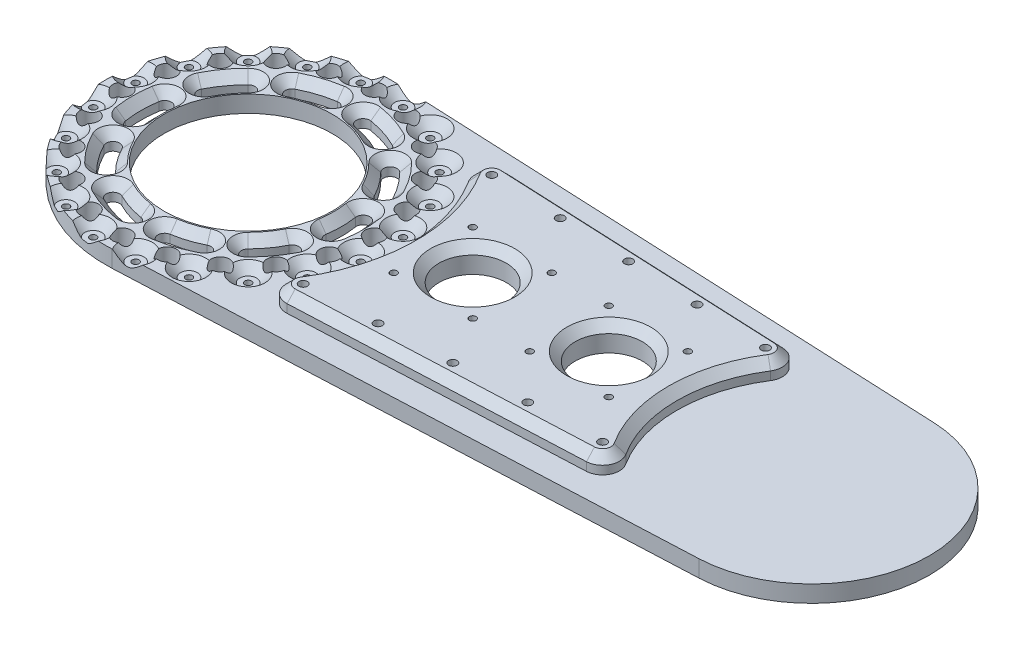
from build123d import *

# Parameters (mm, degrees)
BOSS_EXTRUDE3_OUTLINE_R   = 2
BOSS_EXTRUDE3_OUTLINE_R_2 = 5.5
BOSS_EXTRUDE3_OUTLINE_R_3 = 50
BOSS_EXTRUDE3_DEPTH       = 10
CUT_EXTRUDE1_DEPTH        = 10
SKETCH4_R                 = 5
CUT_EXTRUDE2_DEPTH        = 5
CHAMFER2_SIZE             = 5
SKETCH15_R                = 20
SKETCH15_R_2              = 2
SKETCH15_R_3              = 2.5
CUT_EXTRUDE11_DEPTH       = 10
CUT_EXTRUDE12_START       = 5
SKETCH22_R                = 20
SKETCH22_R_2              = 2
CUT_EXTRUDE12_DEPTH       = 5
BOSS_EXTRUDE10_START      = 20
SKETCH23_R                = 2.5
SKETCH23_R_2              = 20
SKETCH23_R_3              = 2
BOSS_EXTRUDE10_DEPTH      = 15
CHAMFER4_SIZE             = 5
CHAMFER5_SIZE             = 5
SKETCH24_R                = 3.5
SKETCH24_R_2              = 3.53
CUT_EXTRUDE13_DEPTH       = 10


# Read off the part's stored shape, not the designer's step: Boss-Extrude3
with BuildPart() as part:
    # Boss-Extrude3 outline → Boss-Extrude3 (new body)
    with BuildSketch(Plane(origin=(0, 0, 0), x_dir=(1, 0, 0), z_dir=(0, 1, 0))):
        with BuildLine():
            ThreePointArc((338.1374893, -69.914506734), (404.99999947, 0.018309336), (338.131166495, 69.945079648))
            Line((338.131166495, 69.945079648), (3.802131301, 84.914920936))
            ThreePointArc((3.802131301, 84.914920936), (-84.999999913, -0.0038427), (3.809808993, -84.914576814))
            Line((3.809808993, -84.914576814), (338.1374893, -69.914506734))
        make_face()
        with Locations((-36.542992585, -71.727677315)):
            Circle(BOSS_EXTRUDE3_OUTLINE_R, mode=Mode.SUBTRACT)
        with Locations((-12.589379965, -79.509480643)):
            Circle(BOSS_EXTRUDE3_OUTLINE_R, mode=Mode.SUBTRACT)
        with Locations((0, -75)):
            Circle(BOSS_EXTRUDE3_OUTLINE_R_2, mode=Mode.SUBTRACT)
        with Locations((12.596568881, -79.50834203)):
            Circle(BOSS_EXTRUDE3_OUTLINE_R, mode=Mode.SUBTRACT)
        with Locations((-23.176274578, -71.329238722)):
            Circle(BOSS_EXTRUDE3_OUTLINE_R_2, mode=Mode.SUBTRACT)
        with Locations((36.549477799, -71.724372933)):
            Circle(BOSS_EXTRUDE3_OUTLINE_R, mode=Mode.SUBTRACT)
        with Locations((23.176274578, -71.329238722)):
            Circle(BOSS_EXTRUDE3_OUTLINE_R_2, mode=Mode.SUBTRACT)
        with Locations((-56.91952248, -56.924669175)):
            Circle(BOSS_EXTRUDE3_OUTLINE_R, mode=Mode.SUBTRACT)
        with Locations((-44.083893922, -60.676274578)):
            Circle(BOSS_EXTRUDE3_OUTLINE_R_2, mode=Mode.SUBTRACT)
        with Locations((-60.676274578, -44.083893922)):
            Circle(BOSS_EXTRUDE3_OUTLINE_R_2, mode=Mode.SUBTRACT)
        with Locations((44.083893922, -60.676274578)):
            Circle(BOSS_EXTRUDE3_OUTLINE_R_2, mode=Mode.SUBTRACT)
        with Locations((56.924669175, -56.91952248)):
            Circle(BOSS_EXTRUDE3_OUTLINE_R, mode=Mode.SUBTRACT)
        with Locations((60.676274578, -44.083893922)):
            Circle(BOSS_EXTRUDE3_OUTLINE_R_2, mode=Mode.SUBTRACT)
        with Locations((-71.724372933, -36.549477799)):
            Circle(BOSS_EXTRUDE3_OUTLINE_R, mode=Mode.SUBTRACT)
        with Locations((-71.329238722, -23.176274578)):
            Circle(BOSS_EXTRUDE3_OUTLINE_R_2, mode=Mode.SUBTRACT)
        with Locations((-79.50834203, -12.596568881)):
            Circle(BOSS_EXTRUDE3_OUTLINE_R, mode=Mode.SUBTRACT)
        with Locations((71.727677315, -36.542992585)):
            Circle(BOSS_EXTRUDE3_OUTLINE_R, mode=Mode.SUBTRACT)
        with Locations((71.329238722, -23.176274578)):
            Circle(BOSS_EXTRUDE3_OUTLINE_R_2, mode=Mode.SUBTRACT)
        with Locations((79.509480643, -12.589379965)):
            Circle(BOSS_EXTRUDE3_OUTLINE_R, mode=Mode.SUBTRACT)
        with Locations((-75, 0)):
            Circle(BOSS_EXTRUDE3_OUTLINE_R_2, mode=Mode.SUBTRACT)
        with Locations((-79.509480643, 12.589379965)):
            Circle(BOSS_EXTRUDE3_OUTLINE_R, mode=Mode.SUBTRACT)
        Circle(BOSS_EXTRUDE3_OUTLINE_R_3, mode=Mode.SUBTRACT)
        with Locations((-71.329238722, 23.176274578)):
            Circle(BOSS_EXTRUDE3_OUTLINE_R_2, mode=Mode.SUBTRACT)
        with Locations((-71.727677315, 36.542992585)):
            Circle(BOSS_EXTRUDE3_OUTLINE_R, mode=Mode.SUBTRACT)
        with Locations((75, 0)):
            Circle(BOSS_EXTRUDE3_OUTLINE_R_2, mode=Mode.SUBTRACT)
        with Locations((79.50834203, 12.596568881)):
            Circle(BOSS_EXTRUDE3_OUTLINE_R, mode=Mode.SUBTRACT)
        with Locations((71.329238722, 23.176274578)):
            Circle(BOSS_EXTRUDE3_OUTLINE_R_2, mode=Mode.SUBTRACT)
        with Locations((71.724372933, 36.549477799)):
            Circle(BOSS_EXTRUDE3_OUTLINE_R, mode=Mode.SUBTRACT)
        with Locations((-60.676274578, 44.083893922)):
            Circle(BOSS_EXTRUDE3_OUTLINE_R_2, mode=Mode.SUBTRACT)
        with Locations((-56.924669175, 56.91952248)):
            Circle(BOSS_EXTRUDE3_OUTLINE_R, mode=Mode.SUBTRACT)
        with Locations((-44.083893922, 60.676274578)):
            Circle(BOSS_EXTRUDE3_OUTLINE_R_2, mode=Mode.SUBTRACT)
        with Locations((-36.549477799, 71.724372933)):
            Circle(BOSS_EXTRUDE3_OUTLINE_R, mode=Mode.SUBTRACT)
        with Locations((-23.176274578, 71.329238722)):
            Circle(BOSS_EXTRUDE3_OUTLINE_R_2, mode=Mode.SUBTRACT)
        with Locations((23.176274578, 71.329238722)):
            Circle(BOSS_EXTRUDE3_OUTLINE_R_2, mode=Mode.SUBTRACT)
        with Locations((36.542992585, 71.727677315)):
            Circle(BOSS_EXTRUDE3_OUTLINE_R, mode=Mode.SUBTRACT)
        with Locations((-12.596568881, 79.50834203)):
            Circle(BOSS_EXTRUDE3_OUTLINE_R, mode=Mode.SUBTRACT)
        with Locations((0, 75)):
            Circle(BOSS_EXTRUDE3_OUTLINE_R_2, mode=Mode.SUBTRACT)
        with Locations((12.589379965, 79.509480643)):
            Circle(BOSS_EXTRUDE3_OUTLINE_R, mode=Mode.SUBTRACT)
        with Locations((60.676274578, 44.083893922)):
            Circle(BOSS_EXTRUDE3_OUTLINE_R_2, mode=Mode.SUBTRACT)
        with Locations((56.91952248, 56.924669175)):
            Circle(BOSS_EXTRUDE3_OUTLINE_R, mode=Mode.SUBTRACT)
        with Locations((44.083893922, 60.676274578)):
            Circle(BOSS_EXTRUDE3_OUTLINE_R_2, mode=Mode.SUBTRACT)
    extrude(amount=BOSS_EXTRUDE3_DEPTH)

    # Sketch3 → Cut-Extrude1 (cut)
    with BuildSketch(Plane(origin=(0, 10, 0), x_dir=(1, 0, 0), z_dir=(0, 1, 0))):
        with BuildLine():
            ThreePointArc((62.96556447, -9.969964444), (63.74999994, 0.002766756), (62.964698838, 9.97542983))
            ThreePointArc((62.964698838, 9.97542983), (58.388063313, 13.300246709), (55.063246434, 8.723611184))
            ThreePointArc((55.063246434, 8.723611184), (55.749999947, 0.002419555), (55.064003438, -8.718831651))
            ThreePointArc((55.064003438, -8.718831651), (58.389217557, -13.295178563), (62.96556447, -9.969964444))
        make_face()
        with BuildLine():
            ThreePointArc((56.800409782, 28.944359529), (51.573207084, 37.473548151), (45.076100866, 45.08001365))
            ThreePointArc((45.076100866, 45.08001365), (39.419246622, 45.079768142), (39.41949213, 39.422913898))
            ThreePointArc((39.41949213, 39.422913898), (45.101275215, 32.770985246), (49.672515222, 25.312126176))
            ThreePointArc((49.672515222, 25.312126176), (55.052579178, 23.564295572), (56.800409782, 28.944359529))
        make_face()
        with BuildLine():
            ThreePointArc((-9.97542983, 62.964698838), (-19.702464714, 60.628997882), (-28.944359529, 56.800409782))
            ThreePointArc((-28.944359529, 56.800409782), (-30.692190133, 51.420345826), (-25.312126176, 49.672515222))
            ThreePointArc((-25.312126176, 49.672515222), (-17.229998554, 53.02065305), (-8.723611184, 55.063246434))
            ThreePointArc((-8.723611184, 55.063246434), (-5.398794306, 59.639881959), (-9.97542983, 62.964698838))
        make_face()
        with BuildLine():
            ThreePointArc((45.08001365, -45.076100866), (51.576459601, -37.469071446), (56.802921945, -28.939429133))
            ThreePointArc((56.802921945, -28.939429133), (55.054624356, -23.559516909), (49.674712132, -25.307814497))
            ThreePointArc((49.674712132, -25.307814497), (45.104119573, -32.767070323), (39.422913898, -39.41949213))
            ThreePointArc((39.422913898, -39.41949213), (39.423159406, -45.076346374), (45.08001365, -45.076100866))
        make_face()
        with BuildLine():
            ThreePointArc((28.939429133, 56.802921945), (19.697202031, 60.630707831), (9.969964444, 62.96556447))
            ThreePointArc((9.969964444, 62.96556447), (5.393617532, 59.64035035), (8.718831651, 55.064003438))
            ThreePointArc((8.718831651, 55.064003438), (17.225396286, 53.022148417), (25.307814497, 49.674712132))
            ThreePointArc((25.307814497, 49.674712132), (30.687726721, 51.42300972), (28.939429133, 56.802921945))
        make_face()
        with BuildLine():
            ThreePointArc((-62.964698838, -9.97542983), (-58.388063313, -13.300246709), (-55.063246434, -8.723611184))
            ThreePointArc((-55.063246434, -8.723611184), (-55.749999947, -0.002419555), (-55.064003438, 8.718831651))
            ThreePointArc((-55.064003438, 8.718831651), (-58.389217557, 13.295178563), (-62.96556447, 9.969964444))
            ThreePointArc((-62.96556447, 9.969964444), (-63.74999994, -0.002766756), (-62.964698838, -9.97542983))
        make_face()
        with BuildLine():
            ThreePointArc((-56.802921945, 28.939429133), (-55.054624356, 23.559516909), (-49.674712132, 25.307814497))
            ThreePointArc((-49.674712132, 25.307814497), (-45.104119573, 32.767070323), (-39.422913898, 39.41949213))
            ThreePointArc((-39.422913898, 39.41949213), (-39.423159406, 45.076346374), (-45.08001365, 45.076100866))
            ThreePointArc((-45.08001365, 45.076100866), (-51.576459601, 37.469071446), (-56.802921945, 28.939429133))
        make_face()
        with BuildLine():
            ThreePointArc((-45.076100866, -45.08001365), (-39.419246622, -45.079768142), (-39.41949213, -39.422913898))
            ThreePointArc((-39.41949213, -39.422913898), (-45.101275215, -32.770985246), (-49.672515222, -25.312126176))
            ThreePointArc((-49.672515222, -25.312126176), (-55.052579178, -23.564295572), (-56.800409782, -28.944359529))
            ThreePointArc((-56.800409782, -28.944359529), (-51.573207084, -37.473548151), (-45.076100866, -45.08001365))
        make_face()
        with BuildLine():
            ThreePointArc((-25.307814497, -49.674712132), (-30.687726721, -51.42300972), (-28.939429133, -56.802921945))
            ThreePointArc((-28.939429133, -56.802921945), (-19.697202031, -60.630707831), (-9.969964444, -62.96556447))
            ThreePointArc((-9.969964444, -62.96556447), (-5.393617532, -59.64035035), (-8.718831651, -55.064003438))
            ThreePointArc((-8.718831651, -55.064003438), (-17.225396286, -53.022148417), (-25.307814497, -49.674712132))
        make_face()
        with BuildLine():
            ThreePointArc((8.723611184, -55.063246434), (5.398794306, -59.639881959), (9.97542983, -62.964698838))
            ThreePointArc((9.97542983, -62.964698838), (19.702464714, -60.628997882), (28.944359529, -56.800409782))
            ThreePointArc((28.944359529, -56.800409782), (30.692190133, -51.420345826), (25.312126176, -49.672515222))
            ThreePointArc((25.312126176, -49.672515222), (17.229998554, -53.02065305), (8.723611184, -55.063246434))
        make_face()
    extrude(amount=-CUT_EXTRUDE1_DEPTH, mode=Mode.SUBTRACT)

    # Sketch4 → Cut-Extrude2 (cut)
    with BuildSketch(Plane(origin=(0, 10, 0), x_dir=(1, 0, 0), z_dir=(0, 1, 0))):
        with Locations((-79.50834203, -12.596568881)):
            Circle(SKETCH4_R)
        with Locations((-79.509457879, 12.589523729)):
            Circle(SKETCH4_R)
        with Locations((-71.727588476, 36.543266042)):
            Circle(SKETCH4_R)
        with Locations((-56.924477418, 56.919898865)):
            Circle(SKETCH4_R)
        with Locations((-36.549156354, 71.724815405)):
            Circle(SKETCH4_R)
        with Locations((-12.596103674, 79.508807279)):
            Circle(SKETCH4_R)
        with Locations(Location((12.589988936, 79.509923128, 0), (0, 0, 270))):
            Circle(SKETCH4_R)
        with Locations(Location((36.543731249, 71.728053724, 0), (0, 0, 270))):
            Circle(SKETCH4_R)
        with Locations(Location((56.920364072, 56.924942666, 0), (0, 0, 270))):
            Circle(SKETCH4_R)
        with Locations(Location((71.725280612, 36.549621602, 0), (0, 0, 270))):
            Circle(SKETCH4_R)
        with Locations(Location((79.509272486, 12.596568922, 0), (0, 0, 270))):
            Circle(SKETCH4_R)
        with Locations(Location((79.510388335, -12.589523688, 0), (0, 0, 270))):
            Circle(SKETCH4_R)
        with Locations(Location((71.728518931, -36.543266001, 0), (0, 0, 270))):
            Circle(SKETCH4_R)
        with Locations(Location((56.925407873, -56.919898824, 0), (0, 0, 270))):
            Circle(SKETCH4_R)
        with Locations(Location((36.550086809, -71.724815364, 0), (0, 0, 270))):
            Circle(SKETCH4_R)
        with Locations(Location((12.597034129, -79.508807237, 0), (0, 0, 270))):
            Circle(SKETCH4_R)
        with Locations((-12.589058481, -79.509923086)):
            Circle(SKETCH4_R)
        with Locations((-36.542800794, -71.728053683)):
            Circle(SKETCH4_R)
        with Locations((-56.919433617, -56.924942625)):
            Circle(SKETCH4_R)
        with Locations((-71.724350157, -36.549621561)):
            Circle(SKETCH4_R)
    extrude(amount=-CUT_EXTRUDE2_DEPTH, mode=Mode.SUBTRACT)

    # Chamfer2
    # the kernel refuses this chamfer: 5 mm, written as the material it takes off along each edge
    with BuildSketch(Plane(origin=(-59.013972636, 10, 9.349520507), x_dir=(-0.987681550393962, 0, 0.15647733066287803), z_dir=(-0.15647733066287803, 0, -0.987681550393962))) as chamfer2_piece_1:
        Polygon((4 + CHAMFER2_SIZE, 0), (4, -CHAMFER2_SIZE), (4, 0), align=None)
    revolve(axis=Axis((-59.013972636, 10, 9.349520507), (0, 1, 0)), revolution_arc=180, mode=Mode.SUBTRACT)
    with BuildSketch(Plane(origin=(0, 10, 0), x_dir=(-0.9876815503939634, 0, 0.156477330662869), z_dir=(0.156477330662869, 0, 0.9876815503939634))) as chamfer2_piece_2:
        Polygon((55.75 - CHAMFER2_SIZE, 0), (55.75, CHAMFER2_SIZE), (55.75, 0), align=None)
    revolve(axis=Axis((0, 10, 0), (0, -1, 0)), revolution_arc=18, mode=Mode.SUBTRACT)
    with BuildSketch(Plane(origin=(0, 10, 0), x_dir=(-0.9876951289359334, 0, -0.1563915991229388), z_dir=(0.1563915991229388, 0, -0.9876951289359334))) as chamfer2_piece_3:
        Polygon((63.75 + CHAMFER2_SIZE, 0), (63.75, -CHAMFER2_SIZE), (63.75, 0), align=None)
    revolve(axis=Axis((0, 10, 0), (0, 1, 0)), revolution_arc=18, mode=Mode.SUBTRACT)
    with BuildSketch(Plane(origin=(-59.014783954, 10, -9.344398048), x_dir=(0.9876951289359372, 0, 0.15639159912291412), z_dir=(-0.15639159912291412, 0, 0.9876951289359372))) as chamfer2_piece_4:
        Polygon((4 + CHAMFER2_SIZE, 0), (4, -CHAMFER2_SIZE), (4, 0), align=None)
    revolve(axis=Axis((-59.014783954, 10, -9.344398048), (0, 1, 0)), revolution_arc=180, mode=Mode.SUBTRACT)
    with BuildSketch(Plane(origin=(-42.247796498, 10, 42.251463774), x_dir=(-0.707076092017545, 0, 0.707137469023666), z_dir=(-0.707137469023666, 0, -0.707076092017545))) as chamfer2_piece_5:
        Polygon((4 + CHAMFER2_SIZE, 0), (4, -CHAMFER2_SIZE), (4, 0), align=None)
    revolve(axis=Axis((-42.247796498, 10, 42.251463774), (0, 1, 0)), revolution_arc=180, mode=Mode.SUBTRACT)
    with BuildSketch(Plane(origin=(0, 10, 0), x_dir=(-0.7070760920176004, 0, 0.7071374690236107), z_dir=(0.7071374690236107, 0, 0.7070760920176004))) as chamfer2_piece_6:
        Polygon((55.75 - CHAMFER2_SIZE, 0), (55.75, CHAMFER2_SIZE), (55.75, 0), align=None)
    revolve(axis=Axis((0, 10, 0), (0, -1, 0)), revolution_arc=18, mode=Mode.SUBTRACT)
    with BuildSketch(Plane(origin=(0, 10, 0), x_dir=(-0.8909868201174173, 0, 0.45402916908173774), z_dir=(-0.45402916908173774, 0, -0.8909868201174173))) as chamfer2_piece_7:
        Polygon((63.75 + CHAMFER2_SIZE, 0), (63.75, -CHAMFER2_SIZE), (63.75, 0), align=None)
    revolve(axis=Axis((0, 10, 0), (0, 1, 0)), revolution_arc=18, mode=Mode.SUBTRACT)
    with BuildSketch(Plane(origin=(-53.236462502, 10, 27.128242853), x_dir=(0.8909868201174534, 0, -0.4540291690816666), z_dir=(0.4540291690816666, 0, 0.8909868201174534))) as chamfer2_piece_8:
        Polygon((4 + CHAMFER2_SIZE, 0), (4, -CHAMFER2_SIZE), (4, 0), align=None)
    revolve(axis=Axis((-53.236462502, 10, 27.128242853), (0, 1, 0)), revolution_arc=180, mode=Mode.SUBTRACT)
    with BuildSketch(Plane(origin=(-9.344398048, 10, 59.014783954), x_dir=(-0.15639159912293782, 0, 0.9876951289359336), z_dir=(-0.9876951289359336, 0, -0.15639159912293782))) as chamfer2_piece_9:
        Polygon((4 + CHAMFER2_SIZE, 0), (4, -CHAMFER2_SIZE), (4, 0), align=None)
    revolve(axis=Axis((-9.344398048, 10, 59.014783954), (0, 1, 0)), revolution_arc=180, mode=Mode.SUBTRACT)
    with BuildSketch(Plane(origin=(0, 10, 0), x_dir=(-0.156391599122972, 0, 0.9876951289359281), z_dir=(0.9876951289359281, 0, 0.156391599122972))) as chamfer2_piece_10:
        Polygon((55.75 - CHAMFER2_SIZE, 0), (55.75, CHAMFER2_SIZE), (55.75, 0), align=None)
    revolve(axis=Axis((0, 10, 0), (0, -1, 0)), revolution_arc=18, mode=Mode.SUBTRACT)
    with BuildSketch(Plane(origin=(0, 10, 0), x_dir=(-0.45395182954222274, 0, 0.8910262265810523), z_dir=(-0.8910262265810523, 0, -0.45395182954222274))) as chamfer2_piece_11:
        Polygon((63.75 + CHAMFER2_SIZE, 0), (63.75, -CHAMFER2_SIZE), (63.75, 0), align=None)
    revolve(axis=Axis((0, 10, 0), (0, 1, 0)), revolution_arc=18, mode=Mode.SUBTRACT)
    with BuildSketch(Plane(origin=(-27.123621815, 10, 53.238817038), x_dir=(0.45395182954229385, 0, -0.891026226581016), z_dir=(0.891026226581016, 0, 0.45395182954229385))) as chamfer2_piece_12:
        Polygon((4 + CHAMFER2_SIZE, 0), (4, -CHAMFER2_SIZE), (4, 0), align=None)
    revolve(axis=Axis((-27.123621815, 10, 53.238817038), (0, 1, 0)), revolution_arc=180, mode=Mode.SUBTRACT)
    with BuildSketch(Plane(origin=(9.349520507, 10, 59.013972636), x_dir=(-0.1564773306628907, 0, -0.98768155039396), z_dir=(0.98768155039396, 0, -0.1564773306628907))) as chamfer2_piece_13:
        Polygon((4 + CHAMFER2_SIZE, 0), (4, -CHAMFER2_SIZE), (4, 0), align=None)
    revolve(axis=Axis((9.349520507, 10, 59.013972636), (0, 1, 0)), revolution_arc=180, mode=Mode.SUBTRACT)
    with BuildSketch(Plane(origin=(0, 10, 0), x_dir=(0.1564773306628972, 0, 0.9876815503939589), z_dir=(-0.9876815503939589, 0, 0.1564773306628972))) as chamfer2_piece_14:
        Polygon((63.75 + CHAMFER2_SIZE, 0), (63.75, -CHAMFER2_SIZE), (63.75, 0), align=None)
    revolve(axis=Axis((0, 10, 0), (0, 1, 0)), revolution_arc=18, mode=Mode.SUBTRACT)
    with BuildSketch(Plane(origin=(0, 10, 0), x_dir=(0.4540291690816931, 0, 0.89098682011744), z_dir=(0.89098682011744, 0, -0.4540291690816931))) as chamfer2_piece_15:
        Polygon((55.75 - CHAMFER2_SIZE, 0), (55.75, CHAMFER2_SIZE), (55.75, 0), align=None)
    revolve(axis=Axis((0, 10, 0), (0, -1, 0)), revolution_arc=18, mode=Mode.SUBTRACT)
    with BuildSketch(Plane(origin=(27.128242853, 10, 53.236462502), x_dir=(0.45402916908164603, 0, 0.890986820117464), z_dir=(-0.890986820117464, 0, 0.45402916908164603))) as chamfer2_piece_16:
        Polygon((4 + CHAMFER2_SIZE, 0), (4, -CHAMFER2_SIZE), (4, 0), align=None)
    revolve(axis=Axis((27.128242853, 10, 53.236462502), (0, 1, 0)), revolution_arc=180, mode=Mode.SUBTRACT)
    with BuildSketch(Plane(origin=(42.251463774, 10, 42.247796498), x_dir=(-0.7071374690237141, 0, -0.7070760920174971), z_dir=(0.7070760920174971, 0, -0.7071374690237141))) as chamfer2_piece_17:
        Polygon((4 + CHAMFER2_SIZE, 0), (4, -CHAMFER2_SIZE), (4, 0), align=None)
    revolve(axis=Axis((42.251463774, 10, 42.247796498), (0, 1, 0)), revolution_arc=180, mode=Mode.SUBTRACT)
    with BuildSketch(Plane(origin=(0, 10, 0), x_dir=(0.7071374690236412, 0, 0.7070760920175699), z_dir=(-0.7070760920175699, 0, 0.7071374690236412))) as chamfer2_piece_18:
        Polygon((63.75 + CHAMFER2_SIZE, 0), (63.75, -CHAMFER2_SIZE), (63.75, 0), align=None)
    revolve(axis=Axis((0, 10, 0), (0, 1, 0)), revolution_arc=18, mode=Mode.SUBTRACT)
    with BuildSketch(Plane(origin=(0, 10, 0), x_dir=(0.8910262265810269, 0, 0.4539518295422725), z_dir=(0.4539518295422725, 0, -0.8910262265810269))) as chamfer2_piece_19:
        Polygon((55.75 - CHAMFER2_SIZE, 0), (55.75, CHAMFER2_SIZE), (55.75, 0), align=None)
    revolve(axis=Axis((0, 10, 0), (0, -1, 0)), revolution_arc=18, mode=Mode.SUBTRACT)
    with BuildSketch(Plane(origin=(53.238817038, 10, 27.123621815), x_dir=(0.8910262265809425, 0, 0.4539518295424383), z_dir=(-0.4539518295424383, 0, 0.8910262265809425))) as chamfer2_piece_20:
        Polygon((4 + CHAMFER2_SIZE, 0), (4, -CHAMFER2_SIZE), (4, 0), align=None)
    revolve(axis=Axis((53.238817038, 10, 27.123621815), (0, 1, 0)), revolution_arc=180, mode=Mode.SUBTRACT)
    with BuildSketch(Plane(origin=(59.014783954, 10, 9.344398048), x_dir=(-0.9876951289359776, 0, -0.15639159912265974), z_dir=(0.15639159912265974, 0, -0.9876951289359776))) as chamfer2_piece_21:
        Polygon((4 + CHAMFER2_SIZE, 0), (4, -CHAMFER2_SIZE), (4, 0), align=None)
    revolve(axis=Axis((59.014783954, 10, 9.344398048), (0, 1, 0)), revolution_arc=180, mode=Mode.SUBTRACT)
    with BuildSketch(Plane(origin=(0, 10, 0), x_dir=(0.9876951289359344, 0, 0.15639159912293288), z_dir=(-0.15639159912293288, 0, 0.9876951289359344))) as chamfer2_piece_22:
        Polygon((63.75 + CHAMFER2_SIZE, 0), (63.75, -CHAMFER2_SIZE), (63.75, 0), align=None)
    revolve(axis=Axis((0, 10, 0), (0, 1, 0)), revolution_arc=18, mode=Mode.SUBTRACT)
    with BuildSketch(Plane(origin=(0, 10, 0), x_dir=(0.9876815503939652, 0, -0.15647733066285652), z_dir=(-0.15647733066285652, 0, -0.9876815503939652))) as chamfer2_piece_23:
        Polygon((55.75 - CHAMFER2_SIZE, 0), (55.75, CHAMFER2_SIZE), (55.75, 0), align=None)
    revolve(axis=Axis((0, 10, 0), (0, -1, 0)), revolution_arc=18, mode=Mode.SUBTRACT)
    with BuildSketch(Plane(origin=(59.013972636, 10, -9.349520507), x_dir=(0.9876815503940178, 0, -0.15647733066252528), z_dir=(0.15647733066252528, 0, 0.9876815503940178))) as chamfer2_piece_24:
        Polygon((4 + CHAMFER2_SIZE, 0), (4, -CHAMFER2_SIZE), (4, 0), align=None)
    revolve(axis=Axis((59.013972636, 10, -9.349520507), (0, 1, 0)), revolution_arc=180, mode=Mode.SUBTRACT)
    with BuildSketch(Plane(origin=(53.236462502, 10, -27.128242853), x_dir=(-0.8909868201172598, 0, 0.45402916908204666), z_dir=(-0.45402916908204666, 0, -0.8909868201172598))) as chamfer2_piece_25:
        Polygon((4 + CHAMFER2_SIZE, 0), (4, -CHAMFER2_SIZE), (4, 0), align=None)
    revolve(axis=Axis((53.236462502, 10, -27.128242853), (0, 1, 0)), revolution_arc=180, mode=Mode.SUBTRACT)
    with BuildSketch(Plane(origin=(0, 10, 0), x_dir=(0.8909868201174278, 0, -0.45402916908171703), z_dir=(0.45402916908171703, 0, 0.8909868201174278))) as chamfer2_piece_26:
        Polygon((63.75 + CHAMFER2_SIZE, 0), (63.75, -CHAMFER2_SIZE), (63.75, 0), align=None)
    revolve(axis=Axis((0, 10, 0), (0, 1, 0)), revolution_arc=18, mode=Mode.SUBTRACT)
    with BuildSketch(Plane(origin=(0, 10, 0), x_dir=(0.7070760920175798, 0, -0.7071374690236313), z_dir=(-0.7071374690236313, 0, -0.7070760920175798))) as chamfer2_piece_27:
        Polygon((55.75 - CHAMFER2_SIZE, 0), (55.75, CHAMFER2_SIZE), (55.75, 0), align=None)
    revolve(axis=Axis((0, 10, 0), (0, -1, 0)), revolution_arc=18, mode=Mode.SUBTRACT)
    with BuildSketch(Plane(origin=(42.247796498, 10, -42.251463774), x_dir=(0.7070760920178728, 0, -0.7071374690233384), z_dir=(0.7071374690233384, 0, 0.7070760920178728))) as chamfer2_piece_28:
        Polygon((4 + CHAMFER2_SIZE, 0), (4, -CHAMFER2_SIZE), (4, 0), align=None)
    revolve(axis=Axis((42.247796498, 10, -42.251463774), (0, 1, 0)), revolution_arc=180, mode=Mode.SUBTRACT)
    with BuildSketch(Plane(origin=(27.123621815, 10, -53.238817038), x_dir=(-0.45395182954191593, 0, 0.8910262265812087), z_dir=(-0.8910262265812087, 0, -0.45395182954191593))) as chamfer2_piece_29:
        Polygon((4 + CHAMFER2_SIZE, 0), (4, -CHAMFER2_SIZE), (4, 0), align=None)
    revolve(axis=Axis((27.123621815, 10, -53.238817038), (0, 1, 0)), revolution_arc=180, mode=Mode.SUBTRACT)
    with BuildSketch(Plane(origin=(0, 10, 0), x_dir=(0.45395182954226415, 0, -0.8910262265810311), z_dir=(0.8910262265810311, 0, 0.45395182954226415))) as chamfer2_piece_30:
        Polygon((63.75 + CHAMFER2_SIZE, 0), (63.75, -CHAMFER2_SIZE), (63.75, 0), align=None)
    revolve(axis=Axis((0, 10, 0), (0, 1, 0)), revolution_arc=18, mode=Mode.SUBTRACT)
    with BuildSketch(Plane(origin=(0, 10, 0), x_dir=(0.15639159912291864, 0, -0.9876951289359365), z_dir=(-0.9876951289359365, 0, -0.15639159912291864))) as chamfer2_piece_31:
        Polygon((55.75 - CHAMFER2_SIZE, 0), (55.75, CHAMFER2_SIZE), (55.75, 0), align=None)
    revolve(axis=Axis((0, 10, 0), (0, -1, 0)), revolution_arc=18, mode=Mode.SUBTRACT)
    with BuildSketch(Plane(origin=(9.344398048, 10, -59.014783954), x_dir=(0.1563915991233011, 0, -0.987695128935876), z_dir=(0.987695128935876, 0, 0.1563915991233011))) as chamfer2_piece_32:
        Polygon((4 + CHAMFER2_SIZE, 0), (4, -CHAMFER2_SIZE), (4, 0), align=None)
    revolve(axis=Axis((9.344398048, 10, -59.014783954), (0, 1, 0)), revolution_arc=180, mode=Mode.SUBTRACT)
    with BuildSketch(Plane(origin=(-9.349520507, 10, -59.013972636), x_dir=(0.15647733066316172, 0, 0.987681550393917), z_dir=(-0.987681550393917, 0, 0.15647733066316172))) as chamfer2_piece_33:
        Polygon((4 + CHAMFER2_SIZE, 0), (4, -CHAMFER2_SIZE), (4, 0), align=None)
    revolve(axis=Axis((-9.349520507, 10, -59.013972636), (0, 1, 0)), revolution_arc=180, mode=Mode.SUBTRACT)
    with BuildSketch(Plane(origin=(0, 10, 0), x_dir=(-0.15647733066284794, 0, -0.9876815503939667), z_dir=(0.9876815503939667, 0, -0.15647733066284794))) as chamfer2_piece_34:
        Polygon((63.75 + CHAMFER2_SIZE, 0), (63.75, -CHAMFER2_SIZE), (63.75, 0), align=None)
    revolve(axis=Axis((0, 10, 0), (0, 1, 0)), revolution_arc=18, mode=Mode.SUBTRACT)
    with BuildSketch(Plane(origin=(0, 10, 0), x_dir=(-0.45402916908174695, 0, -0.8909868201174126), z_dir=(-0.8909868201174126, 0, 0.45402916908174695))) as chamfer2_piece_35:
        Polygon((55.75 - CHAMFER2_SIZE, 0), (55.75, CHAMFER2_SIZE), (55.75, 0), align=None)
    revolve(axis=Axis((0, 10, 0), (0, -1, 0)), revolution_arc=18, mode=Mode.SUBTRACT)
    with BuildSketch(Plane(origin=(-27.128242853, 10, -53.236462502), x_dir=(-0.4540291690814938, 0, -0.8909868201175415), z_dir=(0.8909868201175415, 0, -0.4540291690814938))) as chamfer2_piece_36:
        Polygon((4 + CHAMFER2_SIZE, 0), (4, -CHAMFER2_SIZE), (4, 0), align=None)
    revolve(axis=Axis((-27.128242853, 10, -53.236462502), (0, 1, 0)), revolution_arc=180, mode=Mode.SUBTRACT)
    with BuildSketch(Plane(origin=(-53.238817038, 10, -27.123621815), x_dir=(-0.8910262265809897, 0, -0.45395182954234553), z_dir=(0.45395182954234553, 0, -0.8910262265809897))) as chamfer2_piece_37:
        Polygon((4 + CHAMFER2_SIZE, 0), (4, -CHAMFER2_SIZE), (4, 0), align=None)
    revolve(axis=Axis((-53.238817038, 10, -27.123621815), (0, 1, 0)), revolution_arc=180, mode=Mode.SUBTRACT)
    with BuildSketch(Plane(origin=(0, 10, 0), x_dir=(-0.8910262265810451, 0, -0.4539518295422369), z_dir=(-0.4539518295422369, 0, 0.8910262265810451))) as chamfer2_piece_38:
        Polygon((55.75 - CHAMFER2_SIZE, 0), (55.75, CHAMFER2_SIZE), (55.75, 0), align=None)
    revolve(axis=Axis((0, 10, 0), (0, -1, 0)), revolution_arc=18, mode=Mode.SUBTRACT)
    with BuildSketch(Plane(origin=(0, 10, 0), x_dir=(-0.7071374690236155, 0, -0.7070760920175956), z_dir=(0.7070760920175956, 0, -0.7071374690236155))) as chamfer2_piece_39:
        Polygon((63.75 + CHAMFER2_SIZE, 0), (63.75, -CHAMFER2_SIZE), (63.75, 0), align=None)
    revolve(axis=Axis((0, 10, 0), (0, 1, 0)), revolution_arc=18, mode=Mode.SUBTRACT)
    with BuildSketch(Plane(origin=(-42.251463774, 10, -42.247796498), x_dir=(0.7071374690237363, 0, 0.7070760920174749), z_dir=(-0.7070760920174749, 0, 0.7071374690237363))) as chamfer2_piece_40:
        Polygon((4 + CHAMFER2_SIZE, 0), (4, -CHAMFER2_SIZE), (4, 0), align=None)
    revolve(axis=Axis((-42.251463774, 10, -42.247796498), (0, 1, 0)), revolution_arc=180, mode=Mode.SUBTRACT)
    with BuildSketch(Plane(origin=(-79.50834203, 10, 12.596568881), x_dir=(-0.9881679862865175, 0, 0.15337545722327575), z_dir=(0.15337545722327575, 0, 0.9881679862865175))) as chamfer2_piece_41_section:
        Polygon((5 + CHAMFER2_SIZE, 0), (5, CHAMFER2_SIZE), (5, 0), align=None)
    chamfer2_piece_41 = revolve(axis=Axis((-79.50834203, 10, 12.596568881), (0, -1, 0)), revolution_arc=359.64, mode=Mode.PRIVATE)
    chamfer2_piece_41 = split(chamfer2_piece_41, bisect_by=Plane(origin=(-72.088913494, 5, 11.421103008), z_dir=(0, 1, 0)), keep=Keep.TOP, mode=Mode.PRIVATE)
    add(chamfer2_piece_41, mode=Mode.SUBTRACT)
    with BuildSketch(Plane(origin=(-71.724350157, 10, 36.549621561), x_dir=(-0.8924072037961467, 0, 0.4512309637123132), z_dir=(0.4512309637123132, 0, 0.8924072037961467))) as chamfer2_piece_42_section:
        Polygon((5 + CHAMFER2_SIZE, 0), (5, CHAMFER2_SIZE), (5, 0), align=None)
    chamfer2_piece_42 = revolve(axis=Axis((-71.724350157, 10, 36.549621561), (0, -1, 0)), revolution_arc=359.64, mode=Mode.PRIVATE)
    chamfer2_piece_42 = split(chamfer2_piece_42, bisect_by=Plane(origin=(-65.031299096, 5, 33.138946068), z_dir=(0, 1, 0)), keep=Keep.TOP, mode=Mode.PRIVATE)
    add(chamfer2_piece_42, mode=Mode.SUBTRACT)
    with BuildSketch(Plane(origin=(-56.919433617, 10, 56.924942625), x_dir=(-0.7092906190259605, 0, 0.7049161778266758), z_dir=(0.7049161778266758, 0, 0.7092906190259605))) as chamfer2_piece_43_section:
        Polygon((5 + CHAMFER2_SIZE, 0), (5, CHAMFER2_SIZE), (5, 0), align=None)
    chamfer2_piece_43 = revolve(axis=Axis((-56.919433617, 10, 56.924942625), (0, -1, 0)), revolution_arc=359.64, mode=Mode.PRIVATE)
    chamfer2_piece_43 = split(chamfer2_piece_43, bisect_by=Plane(origin=(-51.607928252, 5, 51.61292318), z_dir=(0, 1, 0)), keep=Keep.TOP, mode=Mode.PRIVATE)
    add(chamfer2_piece_43, mode=Mode.SUBTRACT)
    with BuildSketch(Plane(origin=(-36.542800794, 10, 71.728053683), x_dir=(-0.4567434411585104, 0, 0.8895984650159207), z_dir=(0.8895984650159207, 0, 0.4567434411585104))) as chamfer2_piece_44_section:
        Polygon((5 + CHAMFER2_SIZE, 0), (5, CHAMFER2_SIZE), (5, 0), align=None)
    chamfer2_piece_44 = revolve(axis=Axis((-36.542800794, 10, 71.728053683), (0, -1, 0)), revolution_arc=359.64, mode=Mode.PRIVATE)
    chamfer2_piece_44 = split(chamfer2_piece_44, bisect_by=Plane(origin=(-33.132770402, 5, 65.034673928), z_dir=(0, 1, 0)), keep=Keep.TOP, mode=Mode.PRIVATE)
    add(chamfer2_piece_44, mode=Mode.SUBTRACT)
    with BuildSketch(Plane(origin=(-12.589058481, 10, 79.509923086), x_dir=(-0.15948723054608585, 0, 0.9871999915380569), z_dir=(0.9871999915380569, 0, 0.15948723054608585))) as chamfer2_piece_45_section:
        Polygon((5 + CHAMFER2_SIZE, 0), (5, CHAMFER2_SIZE), (5, 0), align=None)
    chamfer2_piece_45 = revolve(axis=Axis((-12.589058481, 10, 79.509923086), (0, -1, 0)), revolution_arc=359.64, mode=Mode.PRIVATE)
    chamfer2_piece_45 = split(chamfer2_piece_45, bisect_by=Plane(origin=(-11.414299096, 5, 72.090382655), z_dir=(0, 1, 0)), keep=Keep.TOP, mode=Mode.PRIVATE)
    add(chamfer2_piece_45, mode=Mode.SUBTRACT)
    with BuildSketch(Plane(origin=(12.597034129, 10, 79.508807237), x_dir=(0, 0, 1), z_dir=(-1, 0, 0))) as chamfer2_piece_46_section:
        Polygon((5 + CHAMFER2_SIZE, 0), (5, -CHAMFER2_SIZE), (5, 0), align=None)
    chamfer2_piece_46 = revolve(axis=Axis((12.597034129, 10, 79.508807237), (0, 1, 0)), mode=Mode.PRIVATE)
    chamfer2_piece_46 = split(chamfer2_piece_46, bisect_by=Plane(origin=(12.597034129, 5, 71.996860388), z_dir=(0, 1, 0)), keep=Keep.TOP, mode=Mode.PRIVATE)
    add(chamfer2_piece_46, mode=Mode.SUBTRACT)
    with BuildSketch(Plane(origin=(36.550086809, 10, 71.724815364), x_dir=(0, 0, 1), z_dir=(-1, 0, 0))) as chamfer2_piece_47_section:
        Polygon((5 + CHAMFER2_SIZE, 0), (5, -CHAMFER2_SIZE), (5, 0), align=None)
    chamfer2_piece_47 = revolve(axis=Axis((36.550086809, 10, 71.724815364), (0, 1, 0)), mode=Mode.PRIVATE)
    chamfer2_piece_47 = split(chamfer2_piece_47, bisect_by=Plane(origin=(36.550086809, 5, 64.212868518), z_dir=(0, 1, 0)), keep=Keep.TOP, mode=Mode.PRIVATE)
    add(chamfer2_piece_47, mode=Mode.SUBTRACT)
    with BuildSketch(Plane(origin=(56.925407873, 10, 56.919898824), x_dir=(0, 0, 1), z_dir=(-1, 0, 0))) as chamfer2_piece_48_section:
        Polygon((5 + CHAMFER2_SIZE, 0), (5, -CHAMFER2_SIZE), (5, 0), align=None)
    chamfer2_piece_48 = revolve(axis=Axis((56.925407873, 10, 56.919898824), (0, 1, 0)), mode=Mode.PRIVATE)
    chamfer2_piece_48 = split(chamfer2_piece_48, bisect_by=Plane(origin=(56.925407873, 5, 49.407951977), z_dir=(0, 1, 0)), keep=Keep.TOP, mode=Mode.PRIVATE)
    add(chamfer2_piece_48, mode=Mode.SUBTRACT)
    with BuildSketch(Plane(origin=(71.728518931, 10, 36.543266001), x_dir=(0, 0, 1), z_dir=(-1, 0, 0))) as chamfer2_piece_49_section:
        Polygon((5 + CHAMFER2_SIZE, 0), (5, -CHAMFER2_SIZE), (5, 0), align=None)
    chamfer2_piece_49 = revolve(axis=Axis((71.728518931, 10, 36.543266001), (0, 1, 0)), mode=Mode.PRIVATE)
    chamfer2_piece_49 = split(chamfer2_piece_49, bisect_by=Plane(origin=(71.728518931, 5, 29.031319155), z_dir=(0, 1, 0)), keep=Keep.TOP, mode=Mode.PRIVATE)
    add(chamfer2_piece_49, mode=Mode.SUBTRACT)
    with BuildSketch(Plane(origin=(79.510388335, 10, 12.589523688), x_dir=(0, 0, 1), z_dir=(-1, 0, 0))) as chamfer2_piece_50_section:
        Polygon((5 + CHAMFER2_SIZE, 0), (5, -CHAMFER2_SIZE), (5, 0), align=None)
    chamfer2_piece_50 = revolve(axis=Axis((79.510388335, 10, 12.589523688), (0, 1, 0)), mode=Mode.PRIVATE)
    chamfer2_piece_50 = split(chamfer2_piece_50, bisect_by=Plane(origin=(79.510388335, 5, 5.07757684), z_dir=(0, 1, 0)), keep=Keep.TOP, mode=Mode.PRIVATE)
    add(chamfer2_piece_50, mode=Mode.SUBTRACT)
    with BuildSketch(Plane(origin=(79.509272486, 10, -12.596568922), x_dir=(0, 0, 1), z_dir=(-1, 0, 0))) as chamfer2_piece_51_section:
        Polygon((5 + CHAMFER2_SIZE, 0), (5, -CHAMFER2_SIZE), (5, 0), align=None)
    chamfer2_piece_51 = revolve(axis=Axis((79.509272486, 10, -12.596568922), (0, 1, 0)), mode=Mode.PRIVATE)
    chamfer2_piece_51 = split(chamfer2_piece_51, bisect_by=Plane(origin=(79.509272486, 5, -20.108515768), z_dir=(0, 1, 0)), keep=Keep.TOP, mode=Mode.PRIVATE)
    add(chamfer2_piece_51, mode=Mode.SUBTRACT)
    with BuildSketch(Plane(origin=(71.725280612, 10, -36.549621602), x_dir=(0, 0, 1), z_dir=(-1, 0, 0))) as chamfer2_piece_52_section:
        Polygon((5 + CHAMFER2_SIZE, 0), (5, -CHAMFER2_SIZE), (5, 0), align=None)
    chamfer2_piece_52 = revolve(axis=Axis((71.725280612, 10, -36.549621602), (0, 1, 0)), mode=Mode.PRIVATE)
    chamfer2_piece_52 = split(chamfer2_piece_52, bisect_by=Plane(origin=(71.725280612, 5, -44.061568451), z_dir=(0, 1, 0)), keep=Keep.TOP, mode=Mode.PRIVATE)
    add(chamfer2_piece_52, mode=Mode.SUBTRACT)
    with BuildSketch(Plane(origin=(56.920364072, 10, -56.924942666), x_dir=(0, 0, 1), z_dir=(-1, 0, 0))) as chamfer2_piece_53_section:
        Polygon((5 + CHAMFER2_SIZE, 0), (5, -CHAMFER2_SIZE), (5, 0), align=None)
    chamfer2_piece_53 = revolve(axis=Axis((56.920364072, 10, -56.924942666), (0, 1, 0)), mode=Mode.PRIVATE)
    chamfer2_piece_53 = split(chamfer2_piece_53, bisect_by=Plane(origin=(56.920364072, 5, -64.436889514), z_dir=(0, 1, 0)), keep=Keep.TOP, mode=Mode.PRIVATE)
    add(chamfer2_piece_53, mode=Mode.SUBTRACT)
    with BuildSketch(Plane(origin=(36.543731249, 10, -71.728053724), x_dir=(0, 0, 1), z_dir=(-1, 0, 0))) as chamfer2_piece_54_section:
        Polygon((5 + CHAMFER2_SIZE, 0), (5, -CHAMFER2_SIZE), (5, 0), align=None)
    chamfer2_piece_54 = revolve(axis=Axis((36.543731249, 10, -71.728053724), (0, 1, 0)), mode=Mode.PRIVATE)
    chamfer2_piece_54 = split(chamfer2_piece_54, bisect_by=Plane(origin=(36.543731249, 5, -79.24000057), z_dir=(0, 1, 0)), keep=Keep.TOP, mode=Mode.PRIVATE)
    add(chamfer2_piece_54, mode=Mode.SUBTRACT)
    with BuildSketch(Plane(origin=(12.589988936, 10, -79.509923128), x_dir=(0, 0, 1), z_dir=(-1, 0, 0))) as chamfer2_piece_55_section:
        Polygon((5 + CHAMFER2_SIZE, 0), (5, -CHAMFER2_SIZE), (5, 0), align=None)
    chamfer2_piece_55 = revolve(axis=Axis((12.589988936, 10, -79.509923128), (0, 1, 0)), mode=Mode.PRIVATE)
    chamfer2_piece_55 = split(chamfer2_piece_55, bisect_by=Plane(origin=(12.589988936, 5, -87.021869977), z_dir=(0, 1, 0)), keep=Keep.TOP, mode=Mode.PRIVATE)
    add(chamfer2_piece_55, mode=Mode.SUBTRACT)
    with BuildSketch(Plane(origin=(-12.596103674, 10, -79.508807279), x_dir=(-0.1533689233454433, 0, -0.9881690004001641), z_dir=(-0.9881690004001641, 0, 0.1533689233454433))) as chamfer2_piece_56_section:
        Polygon((5 + CHAMFER2_SIZE, 0), (5, CHAMFER2_SIZE), (5, 0), align=None)
    chamfer2_piece_56 = revolve(axis=Axis((-12.596103674, 10, -79.508807279), (0, -1, 0)), revolution_arc=359.64, mode=Mode.PRIVATE)
    chamfer2_piece_56 = split(chamfer2_piece_56, bisect_by=Plane(origin=(-11.42068686, 5, -72.089370971), z_dir=(0, 1, 0)), keep=Keep.TOP, mode=Mode.PRIVATE)
    add(chamfer2_piece_56, mode=Mode.SUBTRACT)
    with BuildSketch(Plane(origin=(-36.549156354, 10, -71.724815405), x_dir=(-0.45122402700266107, 0, -0.8924107111949642), z_dir=(-0.8924107111949642, 0, 0.45122402700266107))) as chamfer2_piece_57_section:
        Polygon((5 + CHAMFER2_SIZE, 0), (5, CHAMFER2_SIZE), (5, 0), align=None)
    chamfer2_piece_57 = revolve(axis=Axis((-36.549156354, 10, -71.724815405), (0, -1, 0)), revolution_arc=359.64, mode=Mode.PRIVATE)
    chamfer2_piece_57 = split(chamfer2_piece_57, bisect_by=Plane(origin=(-33.138532886, 5, -65.031737833), z_dir=(0, 1, 0)), keep=Keep.TOP, mode=Mode.PRIVATE)
    add(chamfer2_piece_57, mode=Mode.SUBTRACT)
    with BuildSketch(Plane(origin=(-56.924477418, 10, -56.919898865), x_dir=(-0.7049103807429796, 0, -0.7092963803099431), z_dir=(-0.7092963803099431, 0, 0.7049103807429796))) as chamfer2_piece_58_section:
        Polygon((5 + CHAMFER2_SIZE, 0), (5, CHAMFER2_SIZE), (5, 0), align=None)
    chamfer2_piece_58 = revolve(axis=Axis((-56.924477418, 10, -56.919898865), (0, -1, 0)), revolution_arc=359.64, mode=Mode.PRIVATE)
    chamfer2_piece_58 = split(chamfer2_piece_58, bisect_by=Plane(origin=(-51.612501385, 5, -51.608350085), z_dir=(0, 1, 0)), keep=Keep.TOP, mode=Mode.PRIVATE)
    add(chamfer2_piece_58, mode=Mode.SUBTRACT)
    with BuildSketch(Plane(origin=(-71.727588476, 10, -36.543266042), x_dir=(-0.8895949147137159, 0, -0.4567503560102572), z_dir=(-0.4567503560102572, 0, 0.8895949147137159))) as chamfer2_piece_59_section:
        Polygon((5 + CHAMFER2_SIZE, 0), (5, CHAMFER2_SIZE), (5, 0), align=None)
    chamfer2_piece_59 = revolve(axis=Axis((-71.727588476, 10, -36.543266042), (0, -1, 0)), revolution_arc=359.64, mode=Mode.PRIVATE)
    chamfer2_piece_59 = split(chamfer2_piece_59, bisect_by=Plane(origin=(-65.034235227, 5, -33.133183622), z_dir=(0, 1, 0)), keep=Keep.TOP, mode=Mode.PRIVATE)
    add(chamfer2_piece_59, mode=Mode.SUBTRACT)
    with BuildSketch(Plane(origin=(-79.509457879, 10, -12.589523729), x_dir=(-0.9871989369688595, 0, -0.1594937580206624), z_dir=(-0.1594937580206624, 0, 0.9871989369688595))) as chamfer2_piece_60_section:
        Polygon((5 + CHAMFER2_SIZE, 0), (5, CHAMFER2_SIZE), (5, 0), align=None)
    chamfer2_piece_60 = revolve(axis=Axis((-79.509457879, 10, -12.589523729), (0, -1, 0)), revolution_arc=359.64, mode=Mode.PRIVATE)
    chamfer2_piece_60 = split(chamfer2_piece_60, bisect_by=Plane(origin=(-72.089925216, 5, -11.414715285), z_dir=(0, 1, 0)), keep=Keep.TOP, mode=Mode.PRIVATE)
    add(chamfer2_piece_60, mode=Mode.SUBTRACT)

    # Sketch15 → Cut-Extrude11 (cut)
    with BuildSketch(Plane(origin=(0, 10, 0), x_dir=(1, 0, 0), z_dir=(0, 1, 0))):
        with Locations(Location((133.499999085, 0.013862137, 0), (0, 0, 270))):
            Circle(SKETCH15_R)
        with Locations(Location((214.419616149, 0.017691464, 0), (0, 0, 270))):
            Circle(SKETCH15_R)
        with Locations(Location((109.999999085, 23.513862137, 0), (0, 0, 270))):
            Circle(SKETCH15_R_2)
        with Locations(Location((88.766048496, 56.085547464, 0), (0, 0, 270))):
            Circle(SKETCH15_R_3)
        with Locations(Location((131.361691629, 54.178294578, 0), (0, 0, 270))):
            Circle(SKETCH15_R_3)
        with Locations(Location((173.957334762, 52.271041692, 0), (0, 0, 270))):
            Circle(SKETCH15_R_3)
        with Locations(Location((216.552977895, 50.363788806, 0), (0, 0, 270))):
            Circle(SKETCH15_R_3)
        with Locations(Location((259.148621028, 48.45653592, 0), (0, 0, 270))):
            Circle(SKETCH15_R_3)
        with Locations(Location((237.917391882, 23.519915521, 0), (0, 0, 270))):
            Circle(SKETCH15_R_2)
        with Locations(Location((190.917392092, 23.515467196, 0), (0, 0, 270))):
            Circle(SKETCH15_R_2)
        with Locations(Location((156.999999085, 23.513862137, 0), (0, 0, 270))):
            Circle(SKETCH15_R_2)
        with Locations(Location((156.999999085, -23.486137863, 0), (0, 0, 270))):
            Circle(SKETCH15_R_2)
        with Locations(Location((109.999999085, -23.486137863, 0), (0, 0, 270))):
            Circle(SKETCH15_R_2)
        with Locations(Location((190.921840417, -23.484532593, 0), (0, 0, 270))):
            Circle(SKETCH15_R_2)
        with Locations(Location((237.921840206, -23.480084269, 0), (0, 0, 270))):
            Circle(SKETCH15_R_2)
        with Locations(Location((259.143623466, -48.418420139, 0), (0, 0, 270))):
            Circle(SKETCH15_R_3)
        with Locations(Location((216.552951986, -50.32930905, 0), (0, 0, 270))):
            Circle(SKETCH15_R_3)
        with Locations(Location((173.962280505, -52.240197961, 0), (0, 0, 270))):
            Circle(SKETCH15_R_3)
        with Locations(Location((131.371609025, -54.151086872, 0), (0, 0, 270))):
            Circle(SKETCH15_R_3)
        with Locations(Location((88.780937545, -56.061975783, 0), (0, 0, 270))):
            Circle(SKETCH15_R_3)
    extrude(amount=-CUT_EXTRUDE11_DEPTH, mode=Mode.SUBTRACT)

    # Sketch22 → Cut-Extrude12 (cut)
    # profile 1 of 2: a face of its own
    with BuildSketch(Plane(origin=(0, 0, 0), x_dir=(1, 0, 0), z_dir=(0, 1, 0)).offset(CUT_EXTRUDE12_START)):
        with BuildLine():
            ThreePointArc((104.999999085, 23.513862137), (106.464465179, 27.049396043), (109.999999085, 28.513862137))
            Line((109.999999085, 28.513862137), (156.999999085, 28.513862137))
            ThreePointArc((156.999999085, 28.513862137), (160.535532991, 27.049396043), (161.999999085, 23.513862137))
            Line((161.999999085, 23.513862137), (161.999999085, -23.486137863))
            ThreePointArc((161.999999085, -23.486137863), (160.535532991, -27.021671769), (156.999999085, -28.486137863))
            Line((156.999999085, -28.486137863), (109.999999085, -28.486137863))
            ThreePointArc((109.999999085, -28.486137863), (106.464465179, -27.021671769), (104.999999085, -23.486137863))
            Line((104.999999085, -23.486137863), (104.999999085, 23.513862137))
        make_face()
        with Locations(Location((133.499999085, 0.013862137, 0), (0, 0, 270))):
            Circle(SKETCH22_R, mode=Mode.SUBTRACT)
        with Locations(Location((156.999999085, -23.486137863, 0), (0, 0, 270))):
            Circle(SKETCH22_R_2, mode=Mode.SUBTRACT)
        with Locations(Location((109.999999085, -23.486137863, 0), (0, 0, 270))):
            Circle(SKETCH22_R_2, mode=Mode.SUBTRACT)
        with Locations(Location((156.999999085, 23.513862137, 0), (0, 0, 270))):
            Circle(SKETCH22_R_2, mode=Mode.SUBTRACT)
        with Locations(Location((109.999999085, 23.513862137, 0), (0, 0, 270))):
            Circle(SKETCH22_R_2, mode=Mode.SUBTRACT)
    # profile 2 of 2: a face of its own
    with BuildSketch(Plane(origin=(0, 0, 0), x_dir=(1, 0, 0), z_dir=(0, 1, 0)).offset(CUT_EXTRUDE12_START)):
        with BuildLine():
            Line((242.921840184, -23.479611043), (242.917391859, 23.520388747))
            ThreePointArc((242.917391859, 23.520388747), (241.45259115, 27.055784032), (237.916918656, 28.519915498))
            Line((237.916918656, 28.519915498), (190.916918866, 28.515467174))
            ThreePointArc((190.916918866, 28.515467174), (187.381523581, 27.050666465), (185.917392115, 23.514993971))
            Line((185.917392115, 23.514993971), (185.921840439, -23.485005819))
            ThreePointArc((185.921840439, -23.485005819), (187.386641148, -27.020401104), (190.922313643, -28.484532571))
            Line((190.922313643, -28.484532571), (237.922313432, -28.480084246))
            ThreePointArc((237.922313432, -28.480084246), (241.457708717, -27.015283537), (242.921840184, -23.479611043))
        make_face()
        with Locations(Location((214.419616149, 0.017691464, 0), (0, 0, 270))):
            Circle(SKETCH22_R, mode=Mode.SUBTRACT)
        with Locations(Location((237.921840206, -23.480084269, 0), (0, 0, 270))):
            Circle(SKETCH22_R_2, mode=Mode.SUBTRACT)
        with Locations(Location((237.917391882, 23.519915521, 0), (0, 0, 270))):
            Circle(SKETCH22_R_2, mode=Mode.SUBTRACT)
        with Locations(Location((190.917392092, 23.515467196, 0), (0, 0, 270))):
            Circle(SKETCH22_R_2, mode=Mode.SUBTRACT)
        with Locations(Location((190.921840417, -23.484532593, 0), (0, 0, 270))):
            Circle(SKETCH22_R_2, mode=Mode.SUBTRACT)
    extrude(amount=-CUT_EXTRUDE12_DEPTH, mode=Mode.SUBTRACT)

    # Sketch23 → Boss-Extrude10 (add)
    # profile 1 of 3: a face of its own
    with BuildSketch(Plane(origin=(0, 0, 0), x_dir=(1, 0, 0), z_dir=(0, 1, 0)).offset(BOSS_EXTRUDE10_START)):
        with BuildLine():
            Line((179.125503262, 62.049652278), (89.213358061, 66.075538163))
            ThreePointArc((89.213358061, 66.075538163), (80.117932283, 61.106512108), (80.312139116, 50.744066753))
            ThreePointArc((80.312139116, 50.744066753), (94.999999163, 0.012612491), (80.32561016, -50.722739994))
            ThreePointArc((80.32561016, -50.722739994), (80.133715056, -61.084479464), (89.229150367, -66.051925996))
            Line((89.229150367, -66.051925996), (179.130368959, -62.018384478))
            Line((179.130368959, -62.018384478), (259.591836289, -58.408370352))
            ThreePointArc((259.591836289, -58.408370352), (268.018834582, -53.026090661), (267.572109697, -43.036912928))
            ThreePointArc((267.572109697, -43.036912928), (254.999999648, 0.01927178), (267.576551974, 43.074159124))
            ThreePointArc((267.576551974, 43.074159124), (268.023861538, 53.064149823), (259.595930592, 58.446526618))
            Line((259.595930592, 58.446526618), (179.125503262, 62.049652278))
        make_face()
        with Locations(Location((131.371609025, -54.151086872, 0), (0, 0, 270))):
            Circle(SKETCH23_R, mode=Mode.SUBTRACT)
        with Locations(Location((216.552951986, -50.32930905, 0), (0, 0, 270))):
            Circle(SKETCH23_R, mode=Mode.SUBTRACT)
        with Locations(Location((216.552977895, 50.363788806, 0), (0, 0, 270))):
            Circle(SKETCH23_R, mode=Mode.SUBTRACT)
        with Locations(Location((131.361691629, 54.178294578, 0), (0, 0, 270))):
            Circle(SKETCH23_R, mode=Mode.SUBTRACT)
        with Locations(Location((173.957334762, 52.271041692, 0), (0, 0, 270))):
            Circle(SKETCH23_R, mode=Mode.SUBTRACT)
        with Locations(Location((173.962280505, -52.240197961, 0), (0, 0, 270))):
            Circle(SKETCH23_R, mode=Mode.SUBTRACT)
        with Locations(Location((259.143623466, -48.418420139, 0), (0, 0, 270))):
            Circle(SKETCH23_R, mode=Mode.SUBTRACT)
        with Locations(Location((259.148621028, 48.45653592, 0), (0, 0, 270))):
            Circle(SKETCH23_R, mode=Mode.SUBTRACT)
        with Locations(Location((88.766048496, 56.085547464, 0), (0, 0, 270))):
            Circle(SKETCH23_R, mode=Mode.SUBTRACT)
        with Locations(Location((88.780937545, -56.061975783, 0), (0, 0, 270))):
            Circle(SKETCH23_R, mode=Mode.SUBTRACT)
        with BuildLine():
            ThreePointArc((242.917391859, 23.520388747), (241.45259115, 27.055784032), (237.916918656, 28.519915498))
            Line((237.916918656, 28.519915498), (190.916918866, 28.515467174))
            ThreePointArc((190.916918866, 28.515467174), (187.381523581, 27.050666465), (185.917392115, 23.514993971))
            Line((185.917392115, 23.514993971), (185.921840439, -23.485005819))
            ThreePointArc((185.921840439, -23.485005819), (187.386641148, -27.020401104), (190.922313643, -28.484532571))
            Line((190.922313643, -28.484532571), (237.922313432, -28.480084246))
            ThreePointArc((237.922313432, -28.480084246), (241.457708717, -27.015283537), (242.921840184, -23.479611043))
            Line((242.921840184, -23.479611043), (242.917391859, 23.520388747))
        make_face(mode=Mode.SUBTRACT)
        with BuildLine():
            Line((104.999999085, -23.486137863), (104.999999085, 23.513862137))
            ThreePointArc((104.999999085, 23.513862137), (106.464465179, 27.049396043), (109.999999085, 28.513862137))
            Line((109.999999085, 28.513862137), (156.999999085, 28.513862137))
            ThreePointArc((156.999999085, 28.513862137), (160.535532991, 27.049396043), (161.999999085, 23.513862137))
            Line((161.999999085, 23.513862137), (161.999999085, -23.486137863))
            ThreePointArc((161.999999085, -23.486137863), (160.535532991, -27.021671769), (156.999999085, -28.486137863))
            Line((156.999999085, -28.486137863), (109.999999085, -28.486137863))
            ThreePointArc((109.999999085, -28.486137863), (106.464465179, -27.021671769), (104.999999085, -23.486137863))
        make_face(mode=Mode.SUBTRACT)
    # profile 2 of 3: a face of its own
    with BuildSketch(Plane(origin=(0, 0, 0), x_dir=(1, 0, 0), z_dir=(0, 1, 0)).offset(BOSS_EXTRUDE10_START)):
        with BuildLine():
            ThreePointArc((104.999999085, 23.513862137), (106.464465179, 27.049396043), (109.999999085, 28.513862137))
            Line((109.999999085, 28.513862137), (156.999999085, 28.513862137))
            ThreePointArc((156.999999085, 28.513862137), (160.535532991, 27.049396043), (161.999999085, 23.513862137))
            Line((161.999999085, 23.513862137), (161.999999085, -23.486137863))
            ThreePointArc((161.999999085, -23.486137863), (160.535532991, -27.021671769), (156.999999085, -28.486137863))
            Line((156.999999085, -28.486137863), (109.999999085, -28.486137863))
            ThreePointArc((109.999999085, -28.486137863), (106.464465179, -27.021671769), (104.999999085, -23.486137863))
            Line((104.999999085, -23.486137863), (104.999999085, 23.513862137))
        make_face()
        with Locations(Location((133.499999085, 0.013862137, 0), (0, 0, 270))):
            Circle(SKETCH23_R_2, mode=Mode.SUBTRACT)
        with Locations(Location((156.999999085, -23.486137863, 0), (0, 0, 270))):
            Circle(SKETCH23_R_3, mode=Mode.SUBTRACT)
        with Locations(Location((109.999999085, -23.486137863, 0), (0, 0, 270))):
            Circle(SKETCH23_R_3, mode=Mode.SUBTRACT)
        with Locations(Location((156.999999085, 23.513862137, 0), (0, 0, 270))):
            Circle(SKETCH23_R_3, mode=Mode.SUBTRACT)
        with Locations(Location((109.999999085, 23.513862137, 0), (0, 0, 270))):
            Circle(SKETCH23_R_3, mode=Mode.SUBTRACT)
    # profile 3 of 3: a face of its own
    with BuildSketch(Plane(origin=(0, 0, 0), x_dir=(1, 0, 0), z_dir=(0, 1, 0)).offset(BOSS_EXTRUDE10_START)):
        with BuildLine():
            Line((242.921840184, -23.479611043), (242.917391859, 23.520388747))
            ThreePointArc((242.917391859, 23.520388747), (241.45259115, 27.055784032), (237.916918656, 28.519915498))
            Line((237.916918656, 28.519915498), (190.916918866, 28.515467174))
            ThreePointArc((190.916918866, 28.515467174), (187.381523581, 27.050666465), (185.917392115, 23.514993971))
            Line((185.917392115, 23.514993971), (185.921840439, -23.485005819))
            ThreePointArc((185.921840439, -23.485005819), (187.386641148, -27.020401104), (190.922313643, -28.484532571))
            Line((190.922313643, -28.484532571), (237.922313432, -28.480084246))
            ThreePointArc((237.922313432, -28.480084246), (241.457708717, -27.015283537), (242.921840184, -23.479611043))
        make_face()
        with Locations(Location((214.419616149, 0.017691464, 0), (0, 0, 270))):
            Circle(SKETCH23_R_2, mode=Mode.SUBTRACT)
        with Locations(Location((237.921840206, -23.480084269, 0), (0, 0, 270))):
            Circle(SKETCH23_R_3, mode=Mode.SUBTRACT)
        with Locations(Location((237.917391882, 23.519915521, 0), (0, 0, 270))):
            Circle(SKETCH23_R_3, mode=Mode.SUBTRACT)
        with Locations(Location((190.917392092, 23.515467196, 0), (0, 0, 270))):
            Circle(SKETCH23_R_3, mode=Mode.SUBTRACT)
        with Locations(Location((190.921840417, -23.484532593, 0), (0, 0, 270))):
            Circle(SKETCH23_R_3, mode=Mode.SUBTRACT)
    extrude(amount=-BOSS_EXTRUDE10_DEPTH)

    # Chamfer4
    chamfer4_edges = [part.edges().sort_by_distance(p)[0] for p in [
        (94.999999163, 20, -0.012612491),
        (80.133715056, 20, 61.084479464),
        (174.410493328, 20, 62.230148174),
        (254.999999648, 20, -0.01927178),
        (268.023861538, 20, -53.064149823),
        (174.404644327, 20, -62.261032391),
        (80.117932283, 20, -61.106512108),
        (268.018834582, 20, 53.026090661),
    ]]
    chamfer(chamfer4_edges, length=CHAMFER4_SIZE)

    # Chamfer5
    chamfer5_edges = [part.edges().sort_by_distance(p)[0] for p in [
        (214.419616149, 20, -20.017691464),
        (133.499999085, 20, -20.013862137),
    ]]
    chamfer(chamfer5_edges, length=CHAMFER5_SIZE)

    # Sketch24 → Cut-Extrude13 (cut)
    with BuildSketch(Plane.XZ):
        with Locations(Location((88.780937545, 56.061975783, 0), (0, 0, 270))):
            Circle(SKETCH24_R)
        with Locations(Location((131.371609025, 54.151086872, 0), (0, 0, 270))):
            Circle(SKETCH24_R)
        with Locations(Location((173.962280505, 52.240197961, 0), (0, 0, 270))):
            Circle(SKETCH24_R)
        with Locations(Location((216.552951986, 50.32930905, 0), (0, 0, 270))):
            Circle(SKETCH24_R)
        with Locations(Location((259.143623466, 48.418420139, 0), (0, 0, 270))):
            Circle(SKETCH24_R_2)
        with Locations(Location((259.148621028, -48.45653592, 0), (0, 0, 270))):
            Circle(SKETCH24_R)
        with Locations(Location((216.552977895, -50.363788806, 0), (0, 0, 270))):
            Circle(SKETCH24_R)
        with Locations(Location((173.957334762, -52.271041692, 0), (0, 0, 270))):
            Circle(SKETCH24_R)
        with Locations(Location((131.361691629, -54.178294578, 0), (0, 0, 270))):
            Circle(SKETCH24_R)
        with Locations(Location((88.766048496, -56.085547464, 0), (0, 0, 270))):
            Circle(SKETCH24_R)
    extrude(amount=-CUT_EXTRUDE13_DEPTH, mode=Mode.SUBTRACT)


solid = part.part
